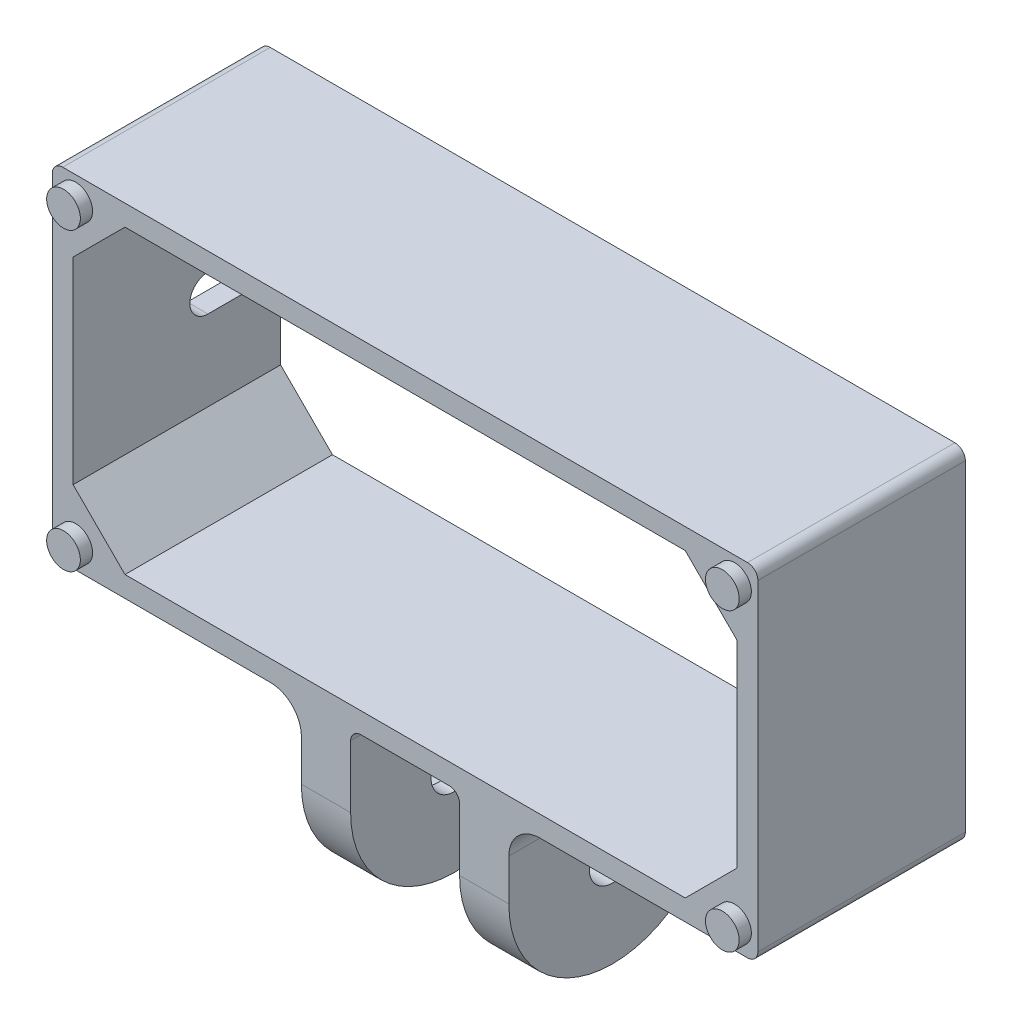
from build123d import *

# Parameters (mm, degrees)
SKETCH1_W           = 68
SKETCH1_H           = 33
BOSS_EXTRUDE1_DEPTH = 20
SKETCH2_R           = 1.625
BOSS_EXTRUDE2_DEPTH = 1.175
FILLET1_R           = 1
CUT_EXTRUDE1_DEPTH  = 13
SKETCH5_W           = 4.75
SKETCH5_H           = 20
BOSS_EXTRUDE3_DEPTH = 17
SKETCH7_R           = 2.25
CUT_EXTRUDE2_DEPTH  = 60.216810324
CUT_EXTRUDE3_DEPTH  = 3.2
FILLET2_R           = 10
FILLET4_R           = 3
FILLET5_R           = 1


with BuildPart() as part:
    # Sketch1 → Boss-Extrude1 (new body)
    with BuildSketch(Plane.XY):
        Rectangle(SKETCH1_W, SKETCH1_H)
        Polygon((-27, 14.5), (-32, 9.5), (-32, -9.5), (-27, -14.5), (27, -14.5), (32, -9.5), (32, 9.5), (27, 14.5), align=None, mode=Mode.SUBTRACT)
    extrude(amount=BOSS_EXTRUDE1_DEPTH)

    # Sketch2 → Boss-Extrude2 (add)
    with BuildSketch(Plane.XY.offset(20)):
        with Locations((31.75, -14.25)):
            Circle(SKETCH2_R)
        with Locations(Location((31.75, 14.25, 0), (0, 0, 180))):
            Circle(SKETCH2_R)
        with Locations((-31.75, 14.25)):
            Circle(SKETCH2_R)
        with Locations(Location((-31.75, -14.25, 0), (0, 0, 180))):
            Circle(SKETCH2_R)
    extrude(amount=BOSS_EXTRUDE2_DEPTH)

    # Fillet1
    fillet1_edges = [part.edges().sort_by_distance(p)[0] for p in [
        (34, -16.5, 10),
        (-34, -16.5, 10),
        (-34, 16.5, 10),
        (34, 16.5, 10),
    ]]
    fillet(fillet1_edges, radius=FILLET1_R)

    # Sketch3 → Cut-Extrude1 (cut)
    with BuildSketch(Plane.ZY.offset(34)):
        with BuildLine():
            Line((7, -1.75), (-7, -1.75))
            ThreePointArc((-7, -1.75), (-8.75, 0), (-7, 1.75))
            Line((-7, 1.75), (7, 1.75))
            ThreePointArc((7, 1.75), (8.75, 0), (7, -1.75))
        make_face()
    extrude(amount=-CUT_EXTRUDE1_DEPTH, mode=Mode.SUBTRACT)

    # Sketch5 → Boss-Extrude3 (add)
    with BuildSketch(Plane.XZ.offset(16.5)):
        with Locations((7.625, 10)):
            Rectangle(SKETCH5_W, SKETCH5_H)
        with Locations((-7.625, 10)):
            Rectangle(SKETCH5_W, SKETCH5_H)
    extrude(amount=BOSS_EXTRUDE3_DEPTH)

    # Sketch7 → Cut-Extrude2 (cut, through all)
    with BuildSketch(Plane.ZY.offset(10)):
        with Locations((10, -24.5)):
            Circle(SKETCH7_R)
    extrude(amount=-CUT_EXTRUDE2_DEPTH, mode=Mode.SUBTRACT)

    # Sketch8 → Cut-Extrude3 (cut)
    with BuildSketch(Plane.ZY.offset(10)):
        Polygon((5.554402927, -24.5), (7.777201464, -28.35), (12.222798536, -28.35), (14.445597073, -24.5), (12.222798536, -20.65), (7.777201464, -20.65), align=None)
    extrude(amount=-CUT_EXTRUDE3_DEPTH, mode=Mode.SUBTRACT)

    # Fillet2
    fillet2_edges = [part.edges().sort_by_distance(p)[0] for p in [
        (7.625, -33.5, 0),
        (7.625, -33.5, 20),
        (-7.625, -33.5, 0),
        (-7.625, -33.5, 20),
    ]]
    fillet(fillet2_edges, radius=FILLET2_R - 0.0001)  # a hair under: the kernel refuses the full size

    # Fillet4
    fillet4_edges = [part.edges().sort_by_distance(p)[0] for p in [
        (10, -16.5, 10),
        (-10, -16.5, 10),
    ]]
    fillet(fillet4_edges, radius=FILLET4_R)

    # Fillet5
    fillet5_edges = [part.edges().sort_by_distance(p)[0] for p in [
        (5.25, -16.5, 10),
        (-5.25, -16.5, 10),
    ]]
    fillet(fillet5_edges, radius=FILLET5_R)


solid = part.part
